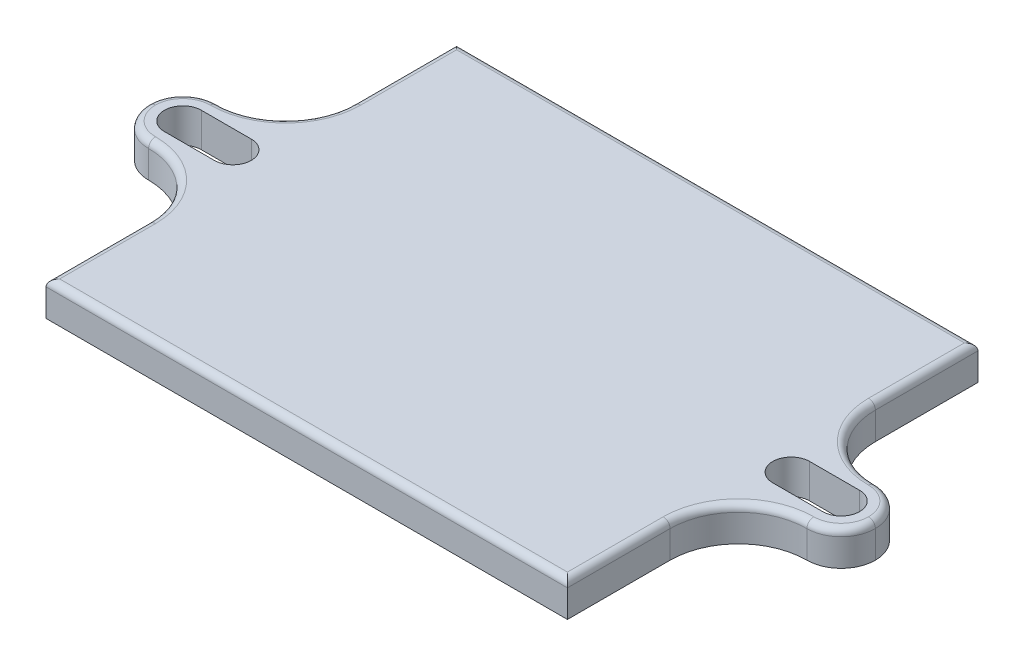
from build123d import *

# Parameters (mm, degrees)
SKETCH1_W           = 76.2
SKETCH1_H           = 60
BOSS_EXTRUDE1_DEPTH = 2.5
SKETCH2_W           = 15
SKETCH2_H           = 10
BOSS_EXTRUDE2_DEPTH = 2.5
CUT_EXTRUDE1_DEPTH  = 10
FILLET1_R           = 10
FILLET2_R           = 5
FILLET3_R           = 1


with BuildPart() as part:
    # Sketch1 → Boss-Extrude1 (new, symmetric)
    with BuildSketch(Plane(origin=(0, 0, 0), x_dir=(1, 0, 0), z_dir=(0, 1, 0))):
        Rectangle(SKETCH1_W, SKETCH1_H)
    extrude(amount=BOSS_EXTRUDE1_DEPTH, both=True)

    # Sketch2 → Boss-Extrude2 (add, symmetric)
    with BuildSketch(Plane(origin=(0, 0, 0), x_dir=(1, 0, 0), z_dir=(0, 1, 0))):
        with Locations((-45.6, 0)):
            Rectangle(SKETCH2_W, SKETCH2_H)
    boss_extrude2 = extrude(amount=BOSS_EXTRUDE2_DEPTH, both=True)

    # Sketch3 → Cut-Extrude1 (cut)
    with BuildSketch(Plane(origin=(0, 2.5, 0), x_dir=(1, 0, 0), z_dir=(0, 1, 0))):
        with BuildLine():
            Line((-48.1, 2.7), (-40.8, 2.7))
            ThreePointArc((-40.8, 2.7), (-38.1, 0), (-40.8, -2.7))
            Line((-40.8, -2.7), (-48.1, -2.7))
            ThreePointArc((-48.1, -2.7), (-50.8, 0), (-48.1, 2.7))
        make_face()
    cut_extrude1 = extrude(amount=-CUT_EXTRUDE1_DEPTH, mode=Mode.SUBTRACT)

    # Mirror4: Boss-Extrude2, Cut-Extrude1 across plane
    add(boss_extrude2.mirror(Plane(origin=(0, 0, 0), x_dir=(0, 0, 1), z_dir=(1, 0, 0))))
    add(cut_extrude1.mirror(Plane(origin=(0, 0, 0), x_dir=(0, 0, 1), z_dir=(1, 0, 0))), mode=Mode.SUBTRACT)

    # Fillet1
    fillet1_edges = [part.edges().sort_by_distance(p)[0] for p in [
        (-38.1, 0, 5),
        (-38.1, 0, -5),
        (38.1, 0, -5),
        (38.1, 0, 5),
    ]]
    fillet(fillet1_edges, radius=FILLET1_R)

    # Fillet2
    fillet2_edges = [part.edges().sort_by_distance(p)[0] for p in [
        (-53.1, 0, -5),
        (-53.1, 0, 5),
        (53.1, 0, -5),
        (53.1, 0, 5),
    ]]
    fillet(fillet2_edges, radius=FILLET2_R - 0.0001)  # a hair under: the kernel refuses the full size

    # Fillet3
    fillet3_edges = [part.edges().sort_by_distance(p)[0] for p in [
        (38.1, 2.5, 22.5),
        (-51.635563195, 2.5, 3.535563195),
        (-51.635563195, 2.5, -3.535563195),
        (51.635563195, 2.5, 3.535563195),
        (51.635563195, 2.5, -3.535563195),
        (0, 2.5, -30),
        (-38.1, 2.5, -22.5),
        (0, 2.5, 30),
        (38.1, 2.5, -22.5),
        (-38.1, 2.5, 22.5),
        (41.028932188, 2.5, -7.928932188),
        (41.028932188, 2.5, 7.928932188),
        (-41.028932188, 2.5, -7.928932188),
        (-41.028932188, 2.5, 7.928932188),
    ]]
    fillet(fillet3_edges, radius=FILLET3_R)


solid = part.part
